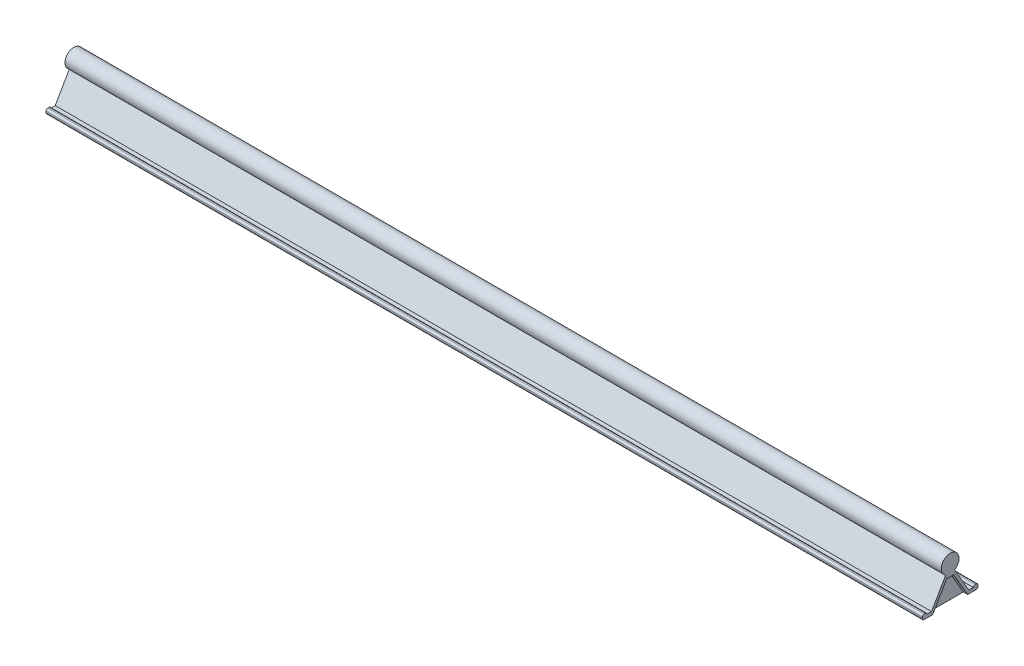
from build123d import *

# Parameters (mm, degrees)
BOSS_EXTRUDE1_DEPTH = 1000
CUT_EXTRUDE1_DEPTH  = 5
FILLET1_R           = 2


with BuildPart() as part:
    # Sketch1 → Boss-Extrude1 (new body)
    with BuildSketch(Plane(origin=(0, 0, 0), x_dir=(0, 0, -1), z_dir=(1, 0, 0))):
        with BuildLine():
            Line((-21.263810414, 3.81), (-5.08, 31.841181898))
            ThreePointArc((-5.08, 31.841181898), (0, 50.8), (5.08, 31.841181898))
            Line((5.08, 31.841181898), (21.263810414, 3.81))
            Line((21.263810414, 3.81), (26.343810414, 3.81))
            Line((26.343810414, 3.81), (26.343810414, 5.588))
            Line((26.343810414, 5.588), (31.75, 5.588))
            Line((31.75, 5.588), (31.75, 0))
            Line((31.75, 0), (-31.75, 0))
            Line((-31.75, 0), (-31.75, 5.588))
            Line((-31.75, 5.588), (-26.343810414, 5.588))
            Line((-26.343810414, 5.588), (-26.343810414, 3.81))
            Line((-26.343810414, 3.81), (-21.263810414, 3.81))
        make_face()
    extrude(amount=BOSS_EXTRUDE1_DEPTH)

    # Sketch2 → Cut-Extrude1 (cut)
    with BuildSketch(Plane.ZY):
        with BuildLine():
            Line((19.999413325, 0), (18.267362517, 3))
            Line((18.267362517, 3), (3.808670233, 28.043189647))
            ThreePointArc((3.808670233, 28.043189647), (0, 27.48), (-3.808670233, 28.043189647))
            Line((-3.808670233, 28.043189647), (-18.267362517, 3))
            Line((-18.267362517, 3), (-19.999413325, 0))
            Line((-19.999413325, 0), (19.999413325, 0))
        make_face()
    cut_extrude1 = extrude(amount=-CUT_EXTRUDE1_DEPTH, mode=Mode.SUBTRACT)

    # Mirror1: Cut-Extrude1 across plane
    add(cut_extrude1.mirror(Plane.ZY.offset(-500)), mode=Mode.SUBTRACT)

    # Fillet1
    # the kernel refuses this fillet: 2 mm, written as the material it takes off along each edge
    with BuildSketch(Plane(origin=(-5, 0, 31.75), x_dir=(0, 1, 0), z_dir=(1, 0, 0)), Plane(origin=(-5, 5.588, 31.75), x_dir=(0, 0, -1), z_dir=(1, 0, 0)), Plane(origin=(-5, 0, -31.75), x_dir=(0, 0, 1), z_dir=(1, 0, 0)), Plane(origin=(-5, 5.588, -31.75), x_dir=(0, -1, 0), z_dir=(1, 0, 0))) as fillet1_piece_1:
        with BuildLine():
            CenterArc((FILLET1_R, -FILLET1_R), FILLET1_R, 90, 90)
            Line((0, -FILLET1_R), (-FILLET1_R * 0.02, -FILLET1_R))
            Line((-FILLET1_R * 0.02, -FILLET1_R), (-FILLET1_R * 0.02, FILLET1_R * 0.02))
            Line((-FILLET1_R * 0.02, FILLET1_R * 0.02), (FILLET1_R, FILLET1_R * 0.02))
            Line((FILLET1_R, FILLET1_R * 0.02), (FILLET1_R, 0))
        make_face()
    extrude(amount=1010, mode=Mode.SUBTRACT)
    with BuildSketch(Plane(origin=(-4.969102032, 5.588, 26.343810414), x_dir=(0, -1, 0), z_dir=(1, 0, 0))) as fillet1_piece_2:
        with BuildLine():
            CenterArc((2, -1.987640813), FILLET1_R, 96.372964386, 83.627035614)
            Line((0, -1.987640813), (-0.04, -1.987640813))
            Line((-0.04, -1.987640813), (-0.04, 0))
            Line((-0.04, 0), (0, 0.04))
            ThreePointArc((0, 0.04), (0.889, 0.04), (1.77356, 0.039752816))
            Line((1.77356, 0.039752816), (1.778, 0))
        make_face()
    extrude(amount=1009.938204063, mode=Mode.SUBTRACT)
    with BuildSketch(Plane(origin=(-4.969102032, 5.588, -26.343810414), x_dir=(0, 0, -1), z_dir=(1, 0, 0))) as fillet1_piece_3:
        with BuildLine():
            CenterArc((1.987640813, -2), FILLET1_R, 90, 83.627035614)
            Line((0, -1.778), (-0.039752816, -1.77356))
            ThreePointArc((-0.039752816, -1.77356), (-0.04, -0.889), (-0.04, 0))
            Line((-0.04, 0), (0, 0.04))
            Line((0, 0.04), (1.987640813, 0.04))
            Line((1.987640813, 0.04), (1.987640813, 0))
        make_face()
    extrude(amount=1009.938204063, mode=Mode.SUBTRACT)


solid = part.part
